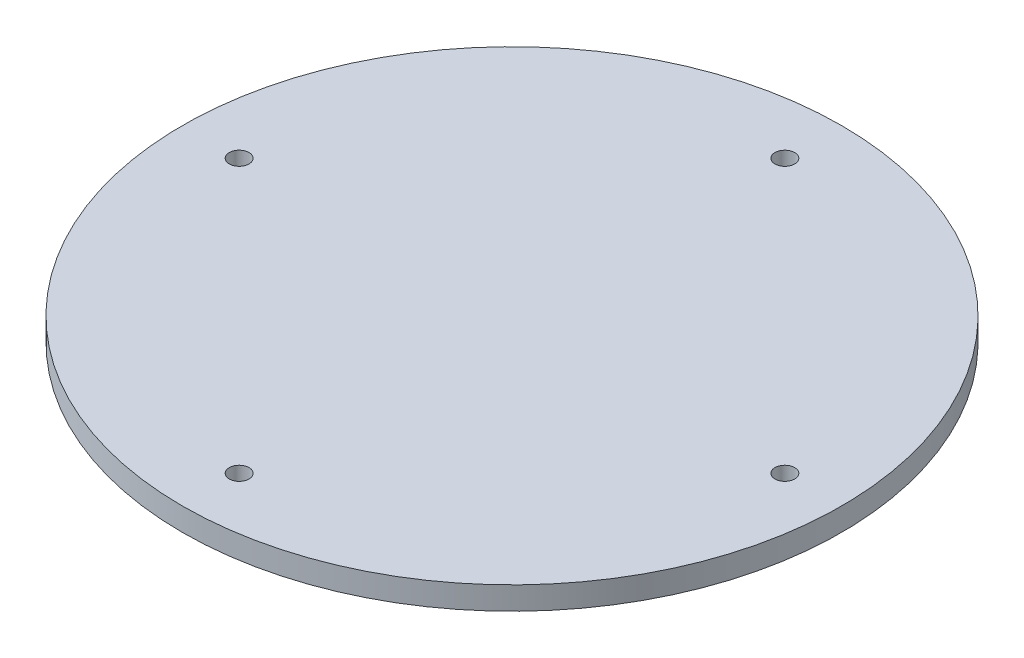
from build123d import *

# Parameters (mm, degrees)
ESQUISSE1_R             = 32.53
BOSS_EXTRU_1_DEPTH      = 8.03
ESQUISSE2_R             = 49.956
BOSS_EXTRU_2_DEPTH      = 3.47
ESQUISSE3_R             = 1.5
ENL_V_MAT_EXTRU_1_DEPTH = 5


with BuildPart() as part:
    # Esquisse1 → Boss.-Extru.1 (new body)
    with BuildSketch(Plane(origin=(0, 0, 0), x_dir=(1, 0, 0), z_dir=(0, 1, 0))):
        Circle(ESQUISSE1_R)
    extrude(amount=-BOSS_EXTRU_1_DEPTH)

    # Esquisse2 → Boss.-Extru.2 (add)
    with BuildSketch(Plane(origin=(0, 0, 0), x_dir=(1, 0, 0), z_dir=(0, 1, 0))):
        Circle(ESQUISSE2_R)
    extrude(amount=BOSS_EXTRU_2_DEPTH)

    # Esquisse3 → Enlèv. mat.-Extru.1 (cut)
    with BuildSketch(Plane(origin=(0, 0, 0), x_dir=(1, 0, 0), z_dir=(0, 1, 0))):
        with Locations((-41.3605, 0)):
            Circle(ESQUISSE3_R)
        with Locations((0, -41.356)):
            Circle(ESQUISSE3_R)
        with Locations((0, 41.356)):
            Circle(ESQUISSE3_R)
        with Locations((41.356, 0)):
            Circle(ESQUISSE3_R)
    extrude(amount=ENL_V_MAT_EXTRU_1_DEPTH, mode=Mode.SUBTRACT)


solid = part.part
